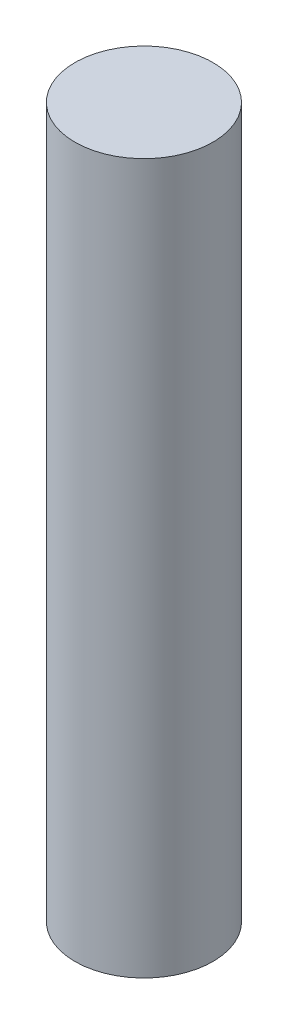
from build123d import *

# Parameters (mm, degrees)
SKETCH1_R           = 12.5
BOSS_EXTRUDE1_DEPTH = 128.524


with BuildPart() as part:
    # Sketch1 → Boss-Extrude1 (new body)
    with BuildSketch(Plane(origin=(0, 0, 0), x_dir=(1, 0, 0), z_dir=(0, 1, 0))):
        Circle(SKETCH1_R)
    extrude(amount=BOSS_EXTRUDE1_DEPTH)


solid = part.part
